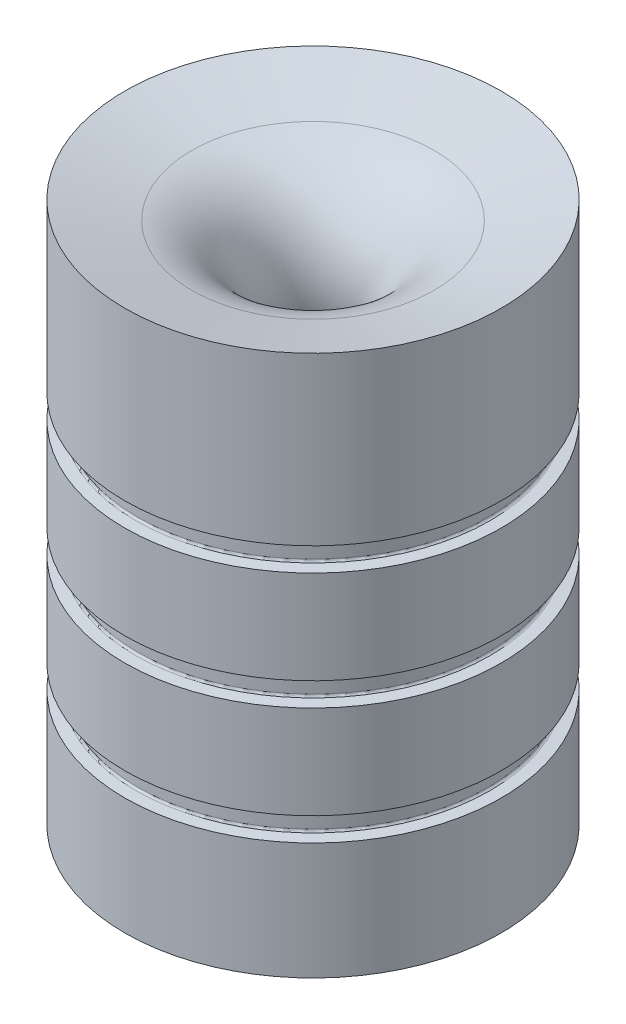
from build123d import *

# Parameters (mm, degrees)
LPATTERN1_COUNT = 3
LPATTERN1_PITCH = 25.635


with BuildPart() as part:
    # Sketch1 → Revolve1 (revolve)
    with BuildSketch(Plane.XY):
        with BuildLine():
            Line((41.275, 118.657114697), (41.275, 0))
            Line((41.275, 0), (34.544, 0))
            Line((34.544, 0), (11.024631822, 87.775477004))
            ThreePointArc((11.024631822, 87.775477004), (13.222441117, 104.469495996), (26.580981008, 114.719864174))
            Line((26.580981008, 114.719864174), (41.275, 118.657114697))
        make_face()
    revolve(axis=Axis((0, 11.203886574, 0), (0, 1, 0)))

    # Sketch3 → Groove for AS 568-234, O-Ring1 (revolve, cut)
    with BuildSketch(Plane(origin=(0, 11.203886574, 0), x_dir=(0, 0, -1), z_dir=(-1, 0, 0))):
        with BuildLine():
            Line((38.861359272, -14.65005737), (41.3639, -14.431113426))
            Line((41.3639, -14.431113426), (41.3639, -19.618801313))
            Line((41.3639, -19.618801313), (38.861359272, -19.39985737))
            ThreePointArc((38.861359272, -19.39985737), (38.572380224, -19.257348674), (38.4556, -18.957048826))
            Line((38.4556, -18.957048826), (38.4556, -15.092865913))
            ThreePointArc((38.4556, -15.092865913), (38.572380224, -14.792566066), (38.861359272, -14.65005737))
        make_face()
    groove_for_as_568_234_o_ring1 = revolve(axis=Axis((0, -38.796113426, 0), (0, 1, 0)), mode=Mode.SUBTRACT)

    # LPattern1: Groove for AS 568-234, O-Ring1 ×3
    with Locations(*[(0, i * LPATTERN1_PITCH, 0) for i in range(1, LPATTERN1_COUNT)]):
        add(groove_for_as_568_234_o_ring1, mode=Mode.SUBTRACT)


solid = part.part
